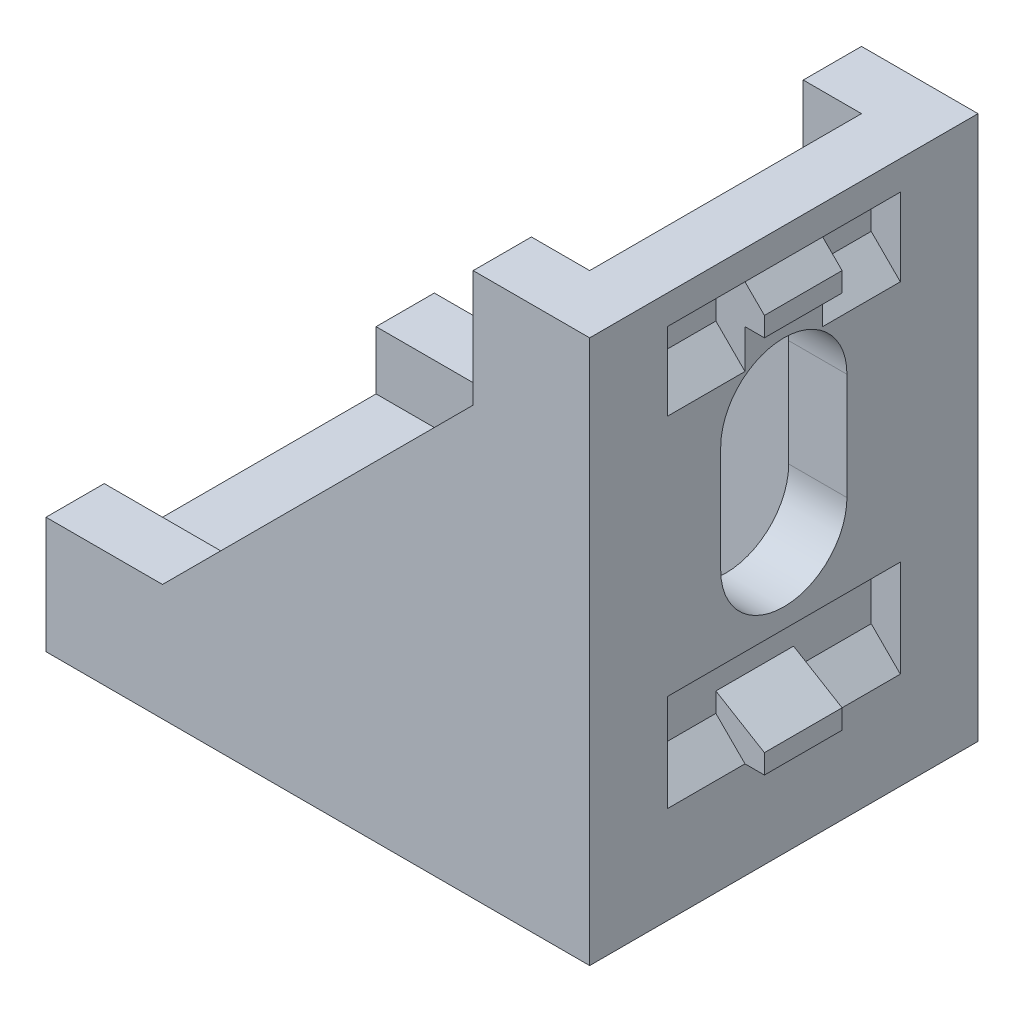
from build123d import *

# Parameters (mm, degrees)
EXTRUDE_1_DEPTH     = 10
SKETCH_4_W          = 25
SKETCH_4_H          = 14
CUT_EXTRUDE_1_DEPTH = 25
LOFT_START          = 2
LOFT_2_DEPTH        = 4
EXTRUDE_2_DEPTH     = 2
CUT_EXTRUDE_2_DEPTH = 33.86335345
LOFT_START_2        = -2
LOFT_4_DEPTH        = 4


# Read off the part's stored shape, not the designer's step: 切除-放样2, 放样4
with BuildPart() as part:
    # Sketch 1 → 凸台-拉伸1 (new, symmetric)
    with BuildSketch(Plane.XY):
        Polygon((-14, -8), (-8, -8), (8, 8), (8, 14), (14, 14), (14, -14), (-14, -14), align=None)
    extrude(amount=EXTRUDE_1_DEPTH, both=True)

    # 草图4 → 切除-拉伸1 (cut)
    with BuildSketch(Plane(origin=(0, 14, 0), x_dir=(1, 0, 0), z_dir=(0, 1, 0))):
        with Locations((-1.5, 0)):
            Rectangle(SKETCH_4_W, SKETCH_4_H)
    extrude(amount=-CUT_EXTRUDE_1_DEPTH, mode=Mode.SUBTRACT)

    # Sketch 1 2 → 切除-放样1 section 0
    with BuildSketch(Plane(origin=(12.5, 0, 0), x_dir=(0, 0, -1), z_dir=(1, 0, 0))):
        with BuildLine():
            Line((6, 10), (6, 12.5))
            Line((6, 12.5), (2, 12.5))
            Line((2, 12.5), (2, 10))
            Line((2, 10), (6, 10))
        make_face()
    # 草图2<110> → 切除-放样1 section 1
    with BuildSketch(Plane(origin=(14, 0, 0), x_dir=(0, 0, -1), z_dir=(1, 0, 0))):
        with BuildLine():
            Line((2, 8.5), (6, 8.5))
            Line((6, 8.5), (6, 12.5))
            Line((6, 12.5), (2, 12.5))
            Line((2, 12.5), (2, 8.5))
        make_face()
    loft_1 = loft(mode=Mode.SUBTRACT)

    # 切除-放样2 outline → 切除-放样2 (cut)
    with BuildSketch(Plane.XY.offset(LOFT_START)):
        Polygon((12.5, 12.5), (12.5, 10), (14, 8.5), (14, 12.5), align=None)
    loft_2 = extrude(amount=LOFT_2_DEPTH, mode=Mode.SUBTRACT)

    # 基准面1草图<9> → 切除-放样3 section 0
    with BuildSketch(Plane(origin=(12.5, 0, 0), x_dir=(0, 0, -1), z_dir=(1, 0, 0))):
        with BuildLine():
            Line((-6, -4), (6, -4))
            Line((6, -4), (6, -7.5))
            Line((6, -7.5), (-6, -7.5))
            Line((-6, -7.5), (-6, -4))
        make_face()
    # 草图2<114> → 切除-放样3 section 1
    with BuildSketch(Plane(origin=(14, 0, 0), x_dir=(0, 0, -1), z_dir=(1, 0, 0))):
        with BuildLine():
            Line((-6, -4), (6, -4))
            Line((6, -4), (6, -9))
            Line((6, -9), (-6, -9))
            Line((-6, -9), (-6, -4))
        make_face()
    loft_3 = loft(mode=Mode.SUBTRACT)

    # 草图9 → 凸台-拉伸2 (add, symmetric)
    with BuildSketch(Plane.XY):
        Polygon((15, -8), (15, -9), (12.5, -9), (12.5, -6.5), align=None)
    extrude_2 = extrude(amount=EXTRUDE_2_DEPTH, both=True)

    # 草图2<115> → 切除-拉伸2 (cut, through all)
    with BuildSketch(Plane(origin=(14, 0, 0), x_dir=(0, 0, -1), z_dir=(1, 0, 0))):
        with BuildLine():
            Line((-3.25, 0.25), (-3.25, 5.75))
            ThreePointArc((-3.25, 5.75), (0, 9), (3.25, 5.75))
            Line((3.25, 5.75), (3.25, 0.25))
            ThreePointArc((3.25, 0.25), (0, -3), (-3.25, 0.25))
        make_face()
    cut_extrude_2 = extrude(amount=-CUT_EXTRUDE_2_DEPTH, mode=Mode.SUBTRACT)

    # 放样4 outline → 放样4 (add)
    with BuildSketch(Plane.XY.offset(LOFT_START_2)):
        Polygon((14, 10.5), (15, 10.5), (15, 11.5), (14, 12.5), align=None)
    loft_4 = extrude(amount=LOFT_4_DEPTH)

    # 镜向1: 切除-放样1, 切除-放样2, 切除-放样3, 凸台-拉伸2, 切除-拉伸2, 放样4 across plane
    add(loft_1.mirror(Plane(origin=(0, 0, 0), x_dir=(0, 0, 1), z_dir=(0.7071067811865474, 0.7071067811865477, 0))), mode=Mode.SUBTRACT)
    add(loft_2.mirror(Plane(origin=(0, 0, 0), x_dir=(0, 0, 1), z_dir=(0.7071067811865474, 0.7071067811865477, 0))), mode=Mode.SUBTRACT)
    add(loft_3.mirror(Plane(origin=(0, 0, 0), x_dir=(0, 0, 1), z_dir=(0.7071067811865474, 0.7071067811865477, 0))), mode=Mode.SUBTRACT)
    add(extrude_2.mirror(Plane(origin=(0, 0, 0), x_dir=(0, 0, 1), z_dir=(0.7071067811865474, 0.7071067811865477, 0))))
    add(cut_extrude_2.mirror(Plane(origin=(0, 0, 0), x_dir=(0, 0, 1), z_dir=(0.7071067811865474, 0.7071067811865477, 0))), mode=Mode.SUBTRACT)
    add(loft_4.mirror(Plane(origin=(0, 0, 0), x_dir=(0, 0, 1), z_dir=(0.7071067811865474, 0.7071067811865477, 0))))


solid = part.part
